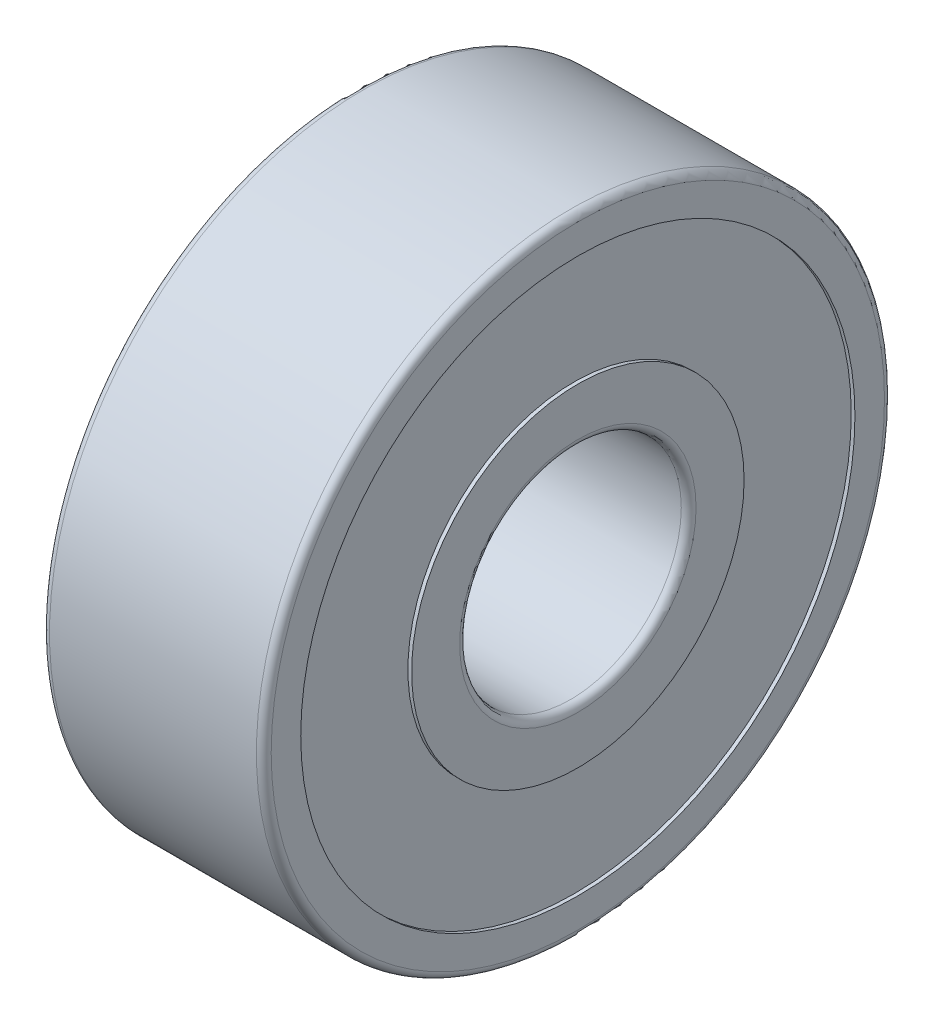
from build123d import *

# Parameters (mm, degrees)
SKETCH1_R           = 8.5
SKETCH1_R_2         = 3
BOSS_EXTRUDE1_DEPTH = 6
SKETCH2_R           = 7.5
SKETCH2_R_2         = 4.5
CUT_EXTRUDE1_DEPTH  = 0.1
CUT_EXTRUDE2_START  = -0.1
SKETCH3_R           = 7.5
SKETCH3_R_2         = 4.5
CUT_EXTRUDE2_DEPTH  = 0.1
FILLET1_R           = 0.2


with BuildPart() as part:
    # Sketch1 → Boss-Extrude1 (new body)
    with BuildSketch(Plane(origin=(0, 0, 0), x_dir=(0, 0, -1), z_dir=(1, 0, 0))):
        Circle(SKETCH1_R)
        Circle(SKETCH1_R_2, mode=Mode.SUBTRACT)
    extrude(amount=BOSS_EXTRUDE1_DEPTH)

    # Sketch2 → Cut-Extrude1 (cut)
    with BuildSketch(Plane(origin=(6, 0, 0), x_dir=(0, 0, -1), z_dir=(1, 0, 0))):
        Circle(SKETCH2_R)
        Circle(SKETCH2_R_2, mode=Mode.SUBTRACT)
    extrude(amount=-CUT_EXTRUDE1_DEPTH, mode=Mode.SUBTRACT)

    # Sketch3 → Cut-Extrude2 (cut)
    with BuildSketch(Plane.ZY.offset(CUT_EXTRUDE2_START)):
        Circle(SKETCH3_R)
        Circle(SKETCH3_R_2, mode=Mode.SUBTRACT)
    extrude(amount=CUT_EXTRUDE2_DEPTH, mode=Mode.SUBTRACT)

    # Fillet1
    fillet1_edges = [part.edges().sort_by_distance(p)[0] for p in [
        (6, 0, 3),
        (6, 0, 8.5),
        (0, 0, 3),
        (0, 0, 8.5),
    ]]
    fillet(fillet1_edges, radius=FILLET1_R)


solid = part.part
